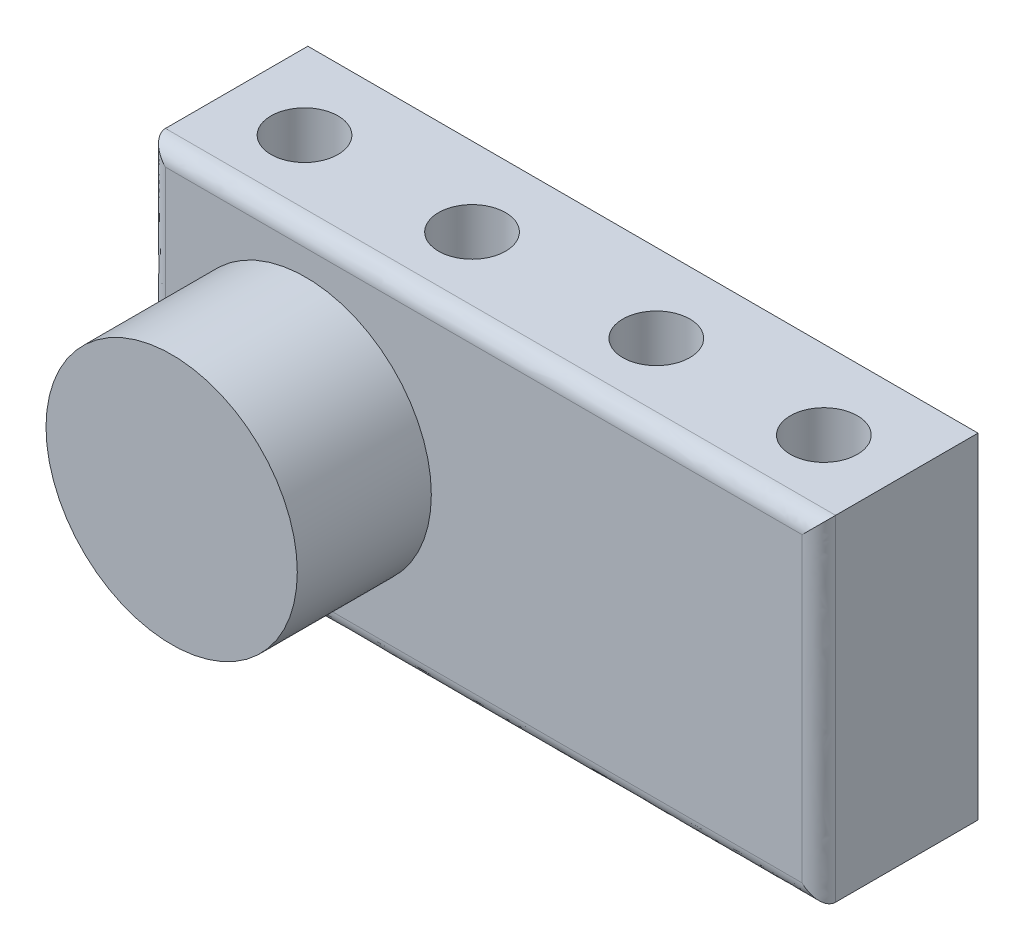
from build123d import *

# Parameters (mm, degrees)
SKETCH1_W           = 40
SKETCH1_H           = 20
BOSS_EXTRUDE1_DEPTH = 9.5
FILLET1_R           = 1
SKETCH4_R           = 7.5
BOSS_EXTRUDE2_DEPTH = 8
SKETCH5_R           = 2
CUT_EXTRUDE1_DEPTH  = 34.260336739


with BuildPart() as part:
    # Sketch1 → Boss-Extrude1 (new body)
    with BuildSketch(Plane.XY):
        Rectangle(SKETCH1_W, SKETCH1_H)
    extrude(amount=BOSS_EXTRUDE1_DEPTH)

    # Fillet1
    fillet1_edges = [part.edges().sort_by_distance(p)[0] for p in [
        (0, -10, 9.5),
        (20, 0, 9.5),
        (0, 10, 9.5),
        (-20, 0, 9.5),
    ]]
    fillet(fillet1_edges, radius=FILLET1_R)

    # Sketch4 → Boss-Extrude2 (add)
    with BuildSketch(Plane.XY.offset(9.5)):
        with Locations((-10.628602575, 0)):
            Circle(SKETCH4_R)
    extrude(amount=BOSS_EXTRUDE2_DEPTH)

    # Sketch5 → Cut-Extrude1 (cut, through all)
    with BuildSketch(Plane.XZ.offset(10)):
        with Locations((-15.5, 4.7)):
            Circle(SKETCH5_R)
        with Locations((-5.5, 4.7)):
            Circle(SKETCH5_R)
        with Locations((5.5, 4.7)):
            Circle(SKETCH5_R)
        with Locations((15.5, 4.7)):
            Circle(SKETCH5_R)
    extrude(amount=-CUT_EXTRUDE1_DEPTH, mode=Mode.SUBTRACT)


solid = part.part
